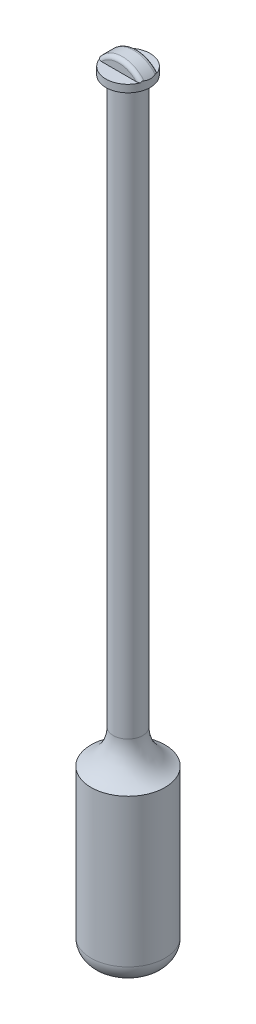
from build123d import *
from build123d.topology import SkipClean

# Parameters (mm, degrees)
SKETCH1_R           = 10
BOSS_EXTRUDE1_DEPTH = 45
FILLET1_R           = 5
SKETCH2_R           = 4
BOSS_EXTRUDE2_DEPTH = 162
SKETCH3_R           = 6
BOSS_EXTRUDE3_DEPTH = 2
BOSS_EXTRUDE4_DEPTH = 2.5
SKETCH5_OUTSIDE_W   = 64.776
SKETCH5_OUTSIDE_H   = 64.776
SKETCH5_OUTSIDE_R   = 6
CUT_EXTRUDE2_DEPTH  = 5
FILLET2_R           = 10
FILLET3_R           = 1


with BuildPart() as part:
    # Sketch1 → Boss-Extrude1 (new body)
    with BuildSketch(Plane(origin=(0, 0, 0), x_dir=(1, 0, 0), z_dir=(0, 1, 0))):
        with Locations(Location((0, 0, 0), (0, 0, 90))):
            Circle(SKETCH1_R)
    extrude(amount=BOSS_EXTRUDE1_DEPTH)

    # Fillet1
    fillet1_edges = [part.edges().sort_by_distance(p)[0] for p in [
        (0, 0, 10),
    ]]
    fillet(fillet1_edges, radius=FILLET1_R)

    # Sketch2 → Boss-Extrude2 (add)
    with BuildSketch(Plane(origin=(0, 45, 0), x_dir=(1, 0, 0), z_dir=(0, 1, 0))):
        with Locations(Location((0, 0, 0), (0, 0, 270))):
            Circle(SKETCH2_R)
    extrude(amount=BOSS_EXTRUDE2_DEPTH)

    # Sketch3 → Boss-Extrude3 (add)
    with BuildSketch(Plane(origin=(0, 207, 0), x_dir=(1, 0, 0), z_dir=(0, 1, 0))):
        with Locations(Location((0, 0, 0), (0, 0, 270))):
            Circle(SKETCH3_R)
    extrude(amount=BOSS_EXTRUDE3_DEPTH)

    # Sketch4 → Boss-Extrude4 (add, symmetric)
    with BuildSketch(Plane.XY):
        with BuildLine():
            Line((-6, 209), (6, 209))
            ThreePointArc((6, 209), (0, 212), (-6, 209))
        make_face()
    extrude(amount=BOSS_EXTRUDE4_DEPTH, both=True)

    # Sketch5 outside → Cut-Extrude2 (cut)
    with SkipClean():  # the faces are left unmerged after this step: merging them gives an invalid solid
        with BuildSketch(Plane.XZ.offset(-207)):
            Rectangle(SKETCH5_OUTSIDE_W, SKETCH5_OUTSIDE_H)
            with Locations(Location((0, 0, 0), (0, 0, 204.624318352))):
                Circle(SKETCH5_OUTSIDE_R, mode=Mode.SUBTRACT)
        extrude(amount=-CUT_EXTRUDE2_DEPTH, mode=Mode.SUBTRACT)
    add(part.part.scale(1), mode=Mode.REPLACE)  # the faces are merged on a copy

    # Fillet2
    # the kernel refuses this fillet: 10 mm, written as the material it adds along each edge
    with BuildSketch(Plane(origin=(0, 45, 0), x_dir=(0, 0, 1), z_dir=(-1, 0, 0))) as fillet2_piece_1:
        with BuildLine():
            CenterArc((14, 9.16515139), FILLET2_R, 180, 66.421821522)
            Line((10, 0), (9.92, -0.183303028))
            ThreePointArc((9.92, -0.183303028), (7, -0.2), (4, -0.2))
            Line((4, -0.2), (3.8, 0))
            Line((3.8, 0), (3.8, 9.16515139))
            Line((3.8, 9.16515139), (4, 9.16515139))
        make_face()
    revolve(axis=Axis((0, 45, 0), (0, 1, 0)))

    # Fillet3
    # the kernel refuses this fillet: 1 mm, written as the material it takes off along each edge
    with BuildSketch(Plane(origin=(0, 204.5, -2.5), x_dir=(0.9118550245849949, 0.41051238000710544, 0), z_dir=(0.41051238000710544, -0.9118550245849949, 0))) as fillet3_piece_1_section:
        with BuildLine():
            CenterArc((7.5 - FILLET3_R, FILLET3_R), FILLET3_R, 270, 90)
            Line((7.5, FILLET3_R), (7.5, 0))
            Line((7.5, 0), (7.5 - FILLET3_R, 0))
        make_face()
    fillet3_piece_1 = revolve(axis=Axis((0, 204.5, -2.5), (0, 0, 1)), revolution_arc=131.52594845, mode=Mode.PRIVATE)
    fillet3_piece_1 = split(fillet3_piece_1, bisect_by=Plane(origin=(0, 209, -2.216936938), z_dir=(0, 1, 0)), keep=Keep.TOP, mode=Mode.PRIVATE)
    add(fillet3_piece_1, mode=Mode.SUBTRACT)
    with BuildSketch(Plane(origin=(0, 204.5, 2.5), x_dir=(0.9118550245849949, 0.4105123800071055, 0), z_dir=(0.4105123800071055, -0.9118550245849949, 0))) as fillet3_piece_2_section:
        with BuildLine():
            CenterArc((7.5 - FILLET3_R, -FILLET3_R), FILLET3_R, 0, 90)
            Line((7.5 - FILLET3_R, 0), (7.5, 0))
            Line((7.5, 0), (7.5, -FILLET3_R))
        make_face()
    fillet3_piece_2 = revolve(axis=Axis((0, 204.5, 2.5), (0, 0, 1)), revolution_arc=131.52594845, mode=Mode.PRIVATE)
    fillet3_piece_2 = split(fillet3_piece_2, bisect_by=Plane(origin=(0, 209, 2.216936937), z_dir=(0, 1, 0)), keep=Keep.TOP, mode=Mode.PRIVATE)
    add(fillet3_piece_2, mode=Mode.SUBTRACT)


solid = part.part
